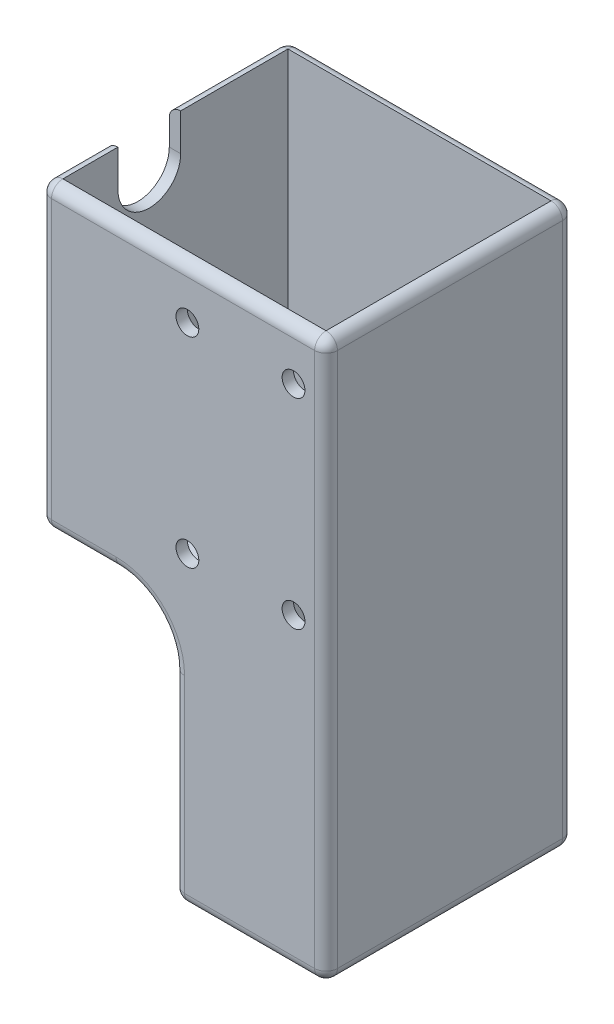
from build123d import *

# Parameters (mm, degrees)
SKETCH1_W                 = 50.11
SKETCH1_H                 = 43.44
BOSS_EXTRUDE1_DEPTH       = 97.79
SKETCH2_W                 = 23.32
SKETCH2_H                 = 45.06
CUT_EXTRUDE1_DEPTH        = 119.156378584
SHELL1_T                  = -2
SHELL1_THICKNESS_2_FACE_W = 39.44
SHELL1_THICKNESS_2_FACE_H = 22.79
SHELL1_THICKNESS_2_DEPTH  = 18.02
SKETCH4_W                 = 6.5
SKETCH4_H                 = 11
CUT_EXTRUDE2_DEPTH        = 2
SKETCH6_R                 = 2
CUT_EXTRUDE3_DEPTH        = 2
CUT_EXTRUDE5_DEPTH        = 2
SKETCH8_R                 = 8.25
CUT_EXTRUDE6_DEPTH        = 20.02
FILLET1_R                 = 10
FILLET2_R                 = 2


with BuildPart() as part:
    # Sketch1 → Boss-Extrude1 (new body)
    with BuildSketch(Plane(origin=(0, 0, 0), x_dir=(1, 0, 0), z_dir=(0, 1, 0))):
        with Locations((25.055, 21.72)):
            Rectangle(SKETCH1_W, SKETCH1_H)
    extrude(amount=BOSS_EXTRUDE1_DEPTH)

    # Sketch2 → Cut-Extrude1 (cut, through all)
    with BuildSketch(Plane.XY):
        with Locations((11.66, 22.53)):
            Rectangle(SKETCH2_W, SKETCH2_H)
    extrude(amount=-CUT_EXTRUDE1_DEPTH, mode=Mode.SUBTRACT)

    # Shell1
    shell1_openings = [part.faces().sort_by_distance(p)[0] for p in [
        (25.055, 97.79, -21.72),
    ]]
    offset(amount=SHELL1_T, openings=shell1_openings, kind=Kind.INTERSECTION)

    # Shell1 thickness 2 face (on inner face of the shell) → Shell1 thickness 2 (add)
    with BuildSketch(Plane(origin=(36.715, 2, -21.72), x_dir=(0, 0, -1), z_dir=(0, -1, 0))):
        Rectangle(SHELL1_THICKNESS_2_FACE_W, SHELL1_THICKNESS_2_FACE_H)
    extrude(amount=-SHELL1_THICKNESS_2_DEPTH)

    # Sketch4 → Cut-Extrude2 (cut)
    with BuildSketch(Plane.XZ.offset(-45.06)):
        with Locations((4.35, -30.69)):
            Rectangle(SKETCH4_W, SKETCH4_H)
    extrude(amount=-CUT_EXTRUDE2_DEPTH, mode=Mode.SUBTRACT)

    # Sketch6 → Cut-Extrude3 (cut)
    with BuildSketch(Plane.XY):
        with Locations((44.415, 88.885)):
            Circle(SKETCH6_R)
        with Locations((25.815, 88.885)):
            Circle(SKETCH6_R)
        with Locations((44.415, 53.805)):
            Circle(SKETCH6_R)
        with Locations((25.815, 53.805)):
            Circle(SKETCH6_R)
    extrude(amount=-CUT_EXTRUDE3_DEPTH, mode=Mode.SUBTRACT)

    # Sketch7 → Cut-Extrude5 (cut)
    with BuildSketch(Plane(origin=(0, 0, 0), x_dir=(0, 0, -1), z_dir=(1, 0, 0))):
        with BuildLine():
            Line((22.64, 91.29), (22.64, 97.79))
            Line((22.64, 97.79), (11.64, 97.79))
            Line((11.64, 97.79), (11.64, 91.29))
            ThreePointArc((11.64, 91.29), (17.14, 85.79), (22.64, 91.29))
        make_face()
    extrude(amount=CUT_EXTRUDE5_DEPTH, mode=Mode.SUBTRACT)

    # Sketch8 → Cut-Extrude6 (cut)
    with BuildSketch(Plane(origin=(0, 0, 0), x_dir=(1, 0, 0), z_dir=(0, 1, 0))):
        with Locations(Location((36.715, 21.72, 0), (0, 0, 90))):
            Circle(SKETCH8_R)
    extrude(amount=CUT_EXTRUDE6_DEPTH, mode=Mode.SUBTRACT)

    # Fillet1
    fillet1_edges = [part.edges().sort_by_distance(p)[0] for p in [
        (23.32, 45.06, -21.72),
    ]]
    fillet(fillet1_edges, radius=FILLET1_R)

    # Fillet2
    # the kernel refuses this fillet: 2 mm, written as the material it takes off along each edge
    with BuildSketch(Plane(origin=(2, 47.06, -2), x_dir=(0, -1, 0), z_dir=(0, 0, 1))) as fillet2_piece_1_section:
        Polygon((0, 0), (FILLET2_R, 0), (FILLET2_R, -FILLET2_R), (0, -FILLET2_R), align=None)
    fillet2_piece_1 = extrude(amount=FILLET2_R, mode=Mode.PRIVATE)
    fillet2_piece_1 = fillet2_piece_1 - Plane(origin=(2, 47.06, -2), x_dir=(0.7071067811865475, 0.7071067811865475, 0), z_dir=(0, 0, 1)) * Sphere(FILLET2_R, mode=Mode.PRIVATE)
    add(fillet2_piece_1, mode=Mode.SUBTRACT)
    with BuildSketch(Plane(origin=(2, 47.06, -41.44), x_dir=(-1, 0, 0), z_dir=(0, -1, 0))) as fillet2_piece_2_section:
        Polygon((0, 0), (FILLET2_R, 0), (FILLET2_R, FILLET2_R), (0, FILLET2_R), align=None)
    fillet2_piece_2 = extrude(amount=FILLET2_R, mode=Mode.PRIVATE)
    fillet2_piece_2 = fillet2_piece_2 - Plane(origin=(2, 47.06, -41.44), x_dir=(0.7071067811865475, 0, 0.7071067811865475), z_dir=(0, -1, 0)) * Sphere(FILLET2_R, mode=Mode.PRIVATE)
    add(fillet2_piece_2, mode=Mode.SUBTRACT)
    with BuildSketch(Plane(origin=(2, 95.79, -2), x_dir=(-1, 0, 0), z_dir=(0, 0, 1))) as fillet2_piece_3_section:
        Polygon((0, 0), (FILLET2_R, 0), (FILLET2_R, -FILLET2_R), (0, -FILLET2_R), align=None)
    fillet2_piece_3 = extrude(amount=FILLET2_R, mode=Mode.PRIVATE)
    fillet2_piece_3 = fillet2_piece_3 - Plane(origin=(2, 95.79, -2), x_dir=(0.7071067811865475, -0.7071067811865475, 0), z_dir=(0, 0, 1)) * Sphere(FILLET2_R, mode=Mode.PRIVATE)
    add(fillet2_piece_3, mode=Mode.SUBTRACT)
    with BuildSketch(Plane(origin=(2, 95.79, -41.44), x_dir=(0, 0, -1), z_dir=(-1, 0, 0))) as fillet2_piece_4_section:
        Polygon((0, 0), (FILLET2_R, 0), (FILLET2_R, -FILLET2_R), (0, -FILLET2_R), align=None)
    fillet2_piece_4 = extrude(amount=FILLET2_R, mode=Mode.PRIVATE)
    fillet2_piece_4 = fillet2_piece_4 - Plane(origin=(2, 95.79, -41.44), x_dir=(0, -0.7071067811865475, 0.7071067811865475), z_dir=(-1, 0, 0)) * Sphere(FILLET2_R, mode=Mode.PRIVATE)
    add(fillet2_piece_4, mode=Mode.SUBTRACT)
    with BuildSketch(Plane(origin=(25.32, 2, -2), x_dir=(-1, 0, 0), z_dir=(0, 0, 1))) as fillet2_piece_5_section:
        Polygon((0, 0), (FILLET2_R, 0), (FILLET2_R, FILLET2_R), (0, FILLET2_R), align=None)
    fillet2_piece_5 = extrude(amount=FILLET2_R, mode=Mode.PRIVATE)
    fillet2_piece_5 = fillet2_piece_5 - Plane(origin=(25.32, 2, -2), x_dir=(0.7071067811865475, 0.7071067811865475, 0), z_dir=(0, 0, 1)) * Sphere(FILLET2_R, mode=Mode.PRIVATE)
    add(fillet2_piece_5, mode=Mode.SUBTRACT)
    with BuildSketch(Plane(origin=(25.32, 2, -41.44), x_dir=(0, 0, -1), z_dir=(-1, 0, 0))) as fillet2_piece_6_section:
        Polygon((0, 0), (FILLET2_R, 0), (FILLET2_R, FILLET2_R), (0, FILLET2_R), align=None)
    fillet2_piece_6 = extrude(amount=FILLET2_R, mode=Mode.PRIVATE)
    fillet2_piece_6 = fillet2_piece_6 - Plane(origin=(25.32, 2, -41.44), x_dir=(0, 0.7071067811865475, 0.7071067811865475), z_dir=(-1, 0, 0)) * Sphere(FILLET2_R, mode=Mode.PRIVATE)
    add(fillet2_piece_6, mode=Mode.SUBTRACT)
    with BuildSketch(Plane(origin=(48.11, 2, -2), x_dir=(0, -1, 0), z_dir=(0, 0, 1))) as fillet2_piece_7_section:
        Polygon((0, 0), (FILLET2_R, 0), (FILLET2_R, FILLET2_R), (0, FILLET2_R), align=None)
    fillet2_piece_7 = extrude(amount=FILLET2_R, mode=Mode.PRIVATE)
    fillet2_piece_7 = fillet2_piece_7 - Plane(origin=(48.11, 2, -2), x_dir=(-0.7071067811865475, 0.7071067811865475, 0), z_dir=(0, 0, 1)) * Sphere(FILLET2_R, mode=Mode.PRIVATE)
    add(fillet2_piece_7, mode=Mode.SUBTRACT)
    with BuildSketch(Plane(origin=(48.11, 95.79, -2), x_dir=(0, 1, 0), z_dir=(0, 0, 1))) as fillet2_piece_8_section:
        Polygon((0, 0), (FILLET2_R, 0), (FILLET2_R, -FILLET2_R), (0, -FILLET2_R), align=None)
    fillet2_piece_8 = extrude(amount=FILLET2_R, mode=Mode.PRIVATE)
    fillet2_piece_8 = fillet2_piece_8 - Plane(origin=(48.11, 95.79, -2), x_dir=(-0.7071067811865475, -0.7071067811865475, 0), z_dir=(0, 0, 1)) * Sphere(FILLET2_R, mode=Mode.PRIVATE)
    add(fillet2_piece_8, mode=Mode.SUBTRACT)
    with BuildSketch(Plane(origin=(48.11, 95.79, -41.44), x_dir=(0, 1, 0), z_dir=(0, 0, -1))) as fillet2_piece_9_section:
        Polygon((0, 0), (FILLET2_R, 0), (FILLET2_R, FILLET2_R), (0, FILLET2_R), align=None)
    fillet2_piece_9 = extrude(amount=FILLET2_R, mode=Mode.PRIVATE)
    fillet2_piece_9 = fillet2_piece_9 - Plane(origin=(48.11, 95.79, -41.44), x_dir=(-0.7071067811865475, -0.7071067811865475, 0), z_dir=(0, 0, -1)) * Sphere(FILLET2_R, mode=Mode.PRIVATE)
    add(fillet2_piece_9, mode=Mode.SUBTRACT)
    with BuildSketch(Plane(origin=(48.11, 2, -41.44), x_dir=(0, -1, 0), z_dir=(0, 0, -1))) as fillet2_piece_10_section:
        Polygon((0, 0), (FILLET2_R, 0), (FILLET2_R, -FILLET2_R), (0, -FILLET2_R), align=None)
    fillet2_piece_10 = extrude(amount=FILLET2_R, mode=Mode.PRIVATE)
    fillet2_piece_10 = fillet2_piece_10 - Plane(origin=(48.11, 2, -41.44), x_dir=(-0.7071067811865475, 0.7071067811865475, 0), z_dir=(0, 0, -1)) * Sphere(FILLET2_R, mode=Mode.PRIVATE)
    add(fillet2_piece_10, mode=Mode.SUBTRACT)
    with BuildSketch(Plane(origin=(0, 45.06, -2), x_dir=(1, 0, 0), z_dir=(0, 0, -1)), Plane(origin=(50.11, 97.79, -2), x_dir=(-1, 0, 0), z_dir=(0, 0, -1))) as fillet2_piece_11:
        with BuildLine():
            CenterArc((FILLET2_R, -FILLET2_R), FILLET2_R, 90, 90)
            Line((0, -FILLET2_R), (0, 0))
            Line((0, 0), (FILLET2_R, 0))
        make_face()
    extrude(amount=39.44, mode=Mode.SUBTRACT)
    with BuildSketch(Plane(origin=(0, 97.79, -16.64), x_dir=(0, -1, 0), z_dir=(0, 0, 1))) as fillet2_piece_12:
        with BuildLine():
            CenterArc((FILLET2_R, FILLET2_R), FILLET2_R, 180, 90)
            Line((0, FILLET2_R), (0, 0))
            Line((0, 0), (FILLET2_R, 0))
        make_face()
    extrude(amount=14.64, mode=Mode.SUBTRACT)
    with BuildSketch(Plane(origin=(0, 47.06, 0), x_dir=(1, 0, 0), z_dir=(0, 1, 0)), Plane(origin=(0, 47.06, -43.44), x_dir=(0, 0, 1), z_dir=(0, 1, 0))) as fillet2_piece_13:
        with BuildLine():
            CenterArc((FILLET2_R, FILLET2_R), FILLET2_R, 180, 90)
            Line((0, FILLET2_R), (0, 0))
            Line((0, 0), (FILLET2_R, 0))
        make_face()
    extrude(amount=48.73, mode=Mode.SUBTRACT)
    with BuildSketch(Plane(origin=(0, 97.79, -41.44), x_dir=(0, -1, 0), z_dir=(0, 0, 1))) as fillet2_piece_14:
        with BuildLine():
            CenterArc((FILLET2_R, FILLET2_R), FILLET2_R, 180, 90)
            Line((0, FILLET2_R), (0, 0))
            Line((0, 0), (FILLET2_R, 0))
        make_face()
    extrude(amount=23.8, mode=Mode.SUBTRACT)
    with BuildSketch(Plane(origin=(13.32, 45.06, 0), x_dir=(0, 1, 0), z_dir=(-1, 0, 0)), Plane(origin=(13.32, 45.06, -43.44), x_dir=(0, 0, 1), z_dir=(-1, 0, 0))) as fillet2_piece_15:
        with BuildLine():
            CenterArc((FILLET2_R, FILLET2_R), FILLET2_R, 180, 90)
            Line((0, FILLET2_R), (0, 0))
            Line((0, 0), (FILLET2_R, 0))
        make_face()
    extrude(amount=11.32, mode=Mode.SUBTRACT)
    with BuildSketch(Plane(origin=(23.32, 2, 0), x_dir=(1, 0, 0), z_dir=(0, 1, 0)), Plane(origin=(23.32, 2, -43.44), x_dir=(0, 0, 1), z_dir=(0, 1, 0))) as fillet2_piece_16:
        with BuildLine():
            CenterArc((FILLET2_R, FILLET2_R), FILLET2_R, 180, 90)
            Line((0, FILLET2_R), (0, 0))
            Line((0, 0), (FILLET2_R, 0))
        make_face()
    extrude(amount=33.06, mode=Mode.SUBTRACT)
    with BuildSketch(Plane(origin=(50.11, 2, 0), x_dir=(-1, 0, 0), z_dir=(0, 1, 0)), Plane(origin=(50.11, 2, -43.44), x_dir=(0, 0, 1), z_dir=(0, 1, 0))) as fillet2_piece_17:
        with BuildLine():
            CenterArc((FILLET2_R, -FILLET2_R), FILLET2_R, 90, 90)
            Line((0, -FILLET2_R), (0, 0))
            Line((0, 0), (FILLET2_R, 0))
        make_face()
    extrude(amount=93.79, mode=Mode.SUBTRACT)
    with BuildSketch(Plane(origin=(25.32, 0, 0), x_dir=(0, 1, 0), z_dir=(1, 0, 0))) as fillet2_piece_18:
        with BuildLine():
            CenterArc((FILLET2_R, -FILLET2_R), FILLET2_R, 90, 90)
            Line((0, -FILLET2_R), (0, 0))
            Line((0, 0), (FILLET2_R, 0))
        make_face()
    extrude(amount=22.79, mode=Mode.SUBTRACT)
    with BuildSketch(Plane(origin=(50.11, 0, -2), x_dir=(-1, 0, 0), z_dir=(0, 0, -1)), Plane(origin=(23.32, 0, -2), x_dir=(0, 1, 0), z_dir=(0, 0, -1))) as fillet2_piece_19:
        with BuildLine():
            CenterArc((FILLET2_R, FILLET2_R), FILLET2_R, 180, 90)
            Line((0, FILLET2_R), (0, 0))
            Line((0, 0), (FILLET2_R, 0))
        make_face()
    extrude(amount=39.44, mode=Mode.SUBTRACT)
    with BuildSketch(Plane(origin=(48.11, 0, -43.44), x_dir=(0, 0, 1), z_dir=(-1, 0, 0))) as fillet2_piece_20:
        with BuildLine():
            CenterArc((FILLET2_R, FILLET2_R), FILLET2_R, 180, 90)
            Line((0, FILLET2_R), (0, 0))
            Line((0, 0), (FILLET2_R, 0))
        make_face()
    extrude(amount=22.79, mode=Mode.SUBTRACT)
    with BuildSketch(Plane(origin=(13.32, 35.06, 0), x_dir=(0, 1, 0), z_dir=(-1, 0, 0))) as fillet2_piece_21:
        with BuildLine():
            CenterArc((10 + FILLET2_R, FILLET2_R), FILLET2_R, 180, 90)
            Line((10, FILLET2_R), (10, 0))
            Line((10, 0), (10 + FILLET2_R, 0))
        make_face()
    revolve(axis=Axis((13.32, 35.06, 0), (0, 0, -1)), revolution_arc=90, mode=Mode.SUBTRACT)
    with BuildSketch(Plane(origin=(13.32, 35.06, -43.44), x_dir=(0, 1, 0), z_dir=(-1, 0, 0))) as fillet2_piece_22:
        with BuildLine():
            CenterArc((10 + FILLET2_R, -FILLET2_R), FILLET2_R, 90, 90)
            Line((10 + FILLET2_R, 0), (10, 0))
            Line((10, 0), (10, -FILLET2_R))
        make_face()
    revolve(axis=Axis((13.32, 35.06, -43.44), (0, 0, -1)), revolution_arc=90, mode=Mode.SUBTRACT)
    with BuildSketch(Plane(origin=(2, 97.79, 0), x_dir=(0, -1, 0), z_dir=(1, 0, 0))) as fillet2_piece_23:
        with BuildLine():
            CenterArc((FILLET2_R, FILLET2_R), FILLET2_R, 180, 90)
            Line((0, FILLET2_R), (0, 0))
            Line((0, 0), (FILLET2_R, 0))
        make_face()
    extrude(amount=46.11, mode=Mode.SUBTRACT)
    with BuildSketch(Plane(origin=(48.11, 97.79, -43.44), x_dir=(0, 0, 1), z_dir=(-1, 0, 0))) as fillet2_piece_24:
        with BuildLine():
            CenterArc((FILLET2_R, -FILLET2_R), FILLET2_R, 90, 90)
            Line((0, -FILLET2_R), (0, 0))
            Line((0, 0), (FILLET2_R, 0))
        make_face()
    extrude(amount=46.11, mode=Mode.SUBTRACT)


solid = part.part
